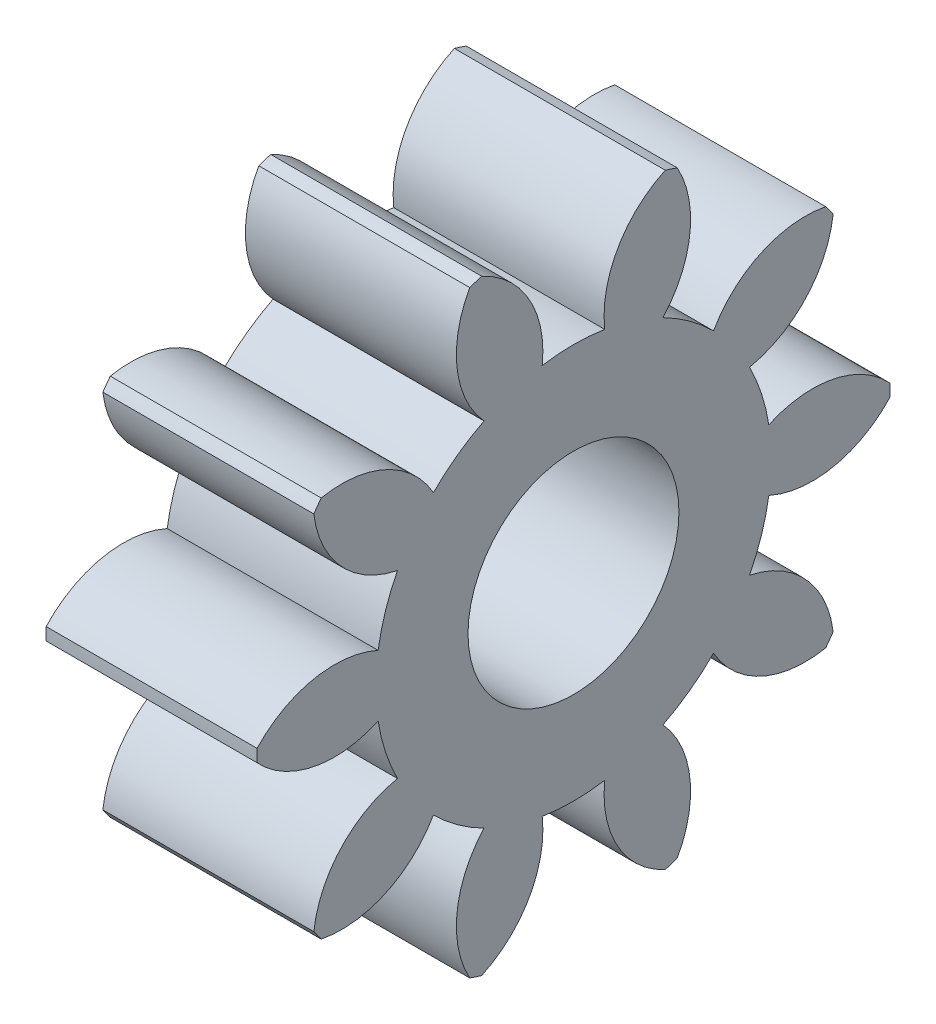
from build123d import *

# Parameters (mm, degrees)
BASPROSKE_W     = 4
BASPROSKE_H     = 6
TOOTHCUT_DEPTH  = 10.38083152
TEETHCUTS_COUNT = 10
TEETHCUTS_ANGLE = 324
BORSKE_R        = 2
BORE_DEPTH      = 50.0000508


with BuildPart() as part:
    # BasProSke → Base-Revolve (revolve)
    with BuildSketch(Plane(origin=(0, 0, 0), x_dir=(1, 0, 0), z_dir=(0, 1, 0))):
        with Locations((2, 3)):
            Rectangle(BASPROSKE_W, BASPROSKE_H)
    revolve(axis=Axis((-10, 0, 0), (1, 0, 0)))

    # TooCutSke → ToothCut (cut, through all)
    with BuildSketch(Plane(origin=(0, 0, 0), x_dir=(0, 0, -1), z_dir=(1, 0, 0))):
        with BuildLine():
            ThreePointArc((0.59278292, 3.701838653), (0, 3.749), (-0.59278292, 3.701838653))
            ThreePointArc((-0.59278292, 3.701838653), (-0.846593509, 4.924114224), (-1.775771316, 5.757784417))
            ThreePointArc((-1.775771316, 5.757784417), (0, 6.0254), (1.775771316, 5.757784417))
            ThreePointArc((1.775771316, 5.757784417), (0.846593509, 4.924114224), (0.59278292, 3.701838653))
        make_face()
    toothcut = extrude(amount=TOOTHCUT_DEPTH, mode=Mode.SUBTRACT)

    # TeethCuts: ToothCut ×10 about axis
    teethcuts_axis = Axis((-10, 0, 0), (1, 0, 0))
    for i in range(1, TEETHCUTS_COUNT):
        add(toothcut.rotate(teethcuts_axis, i * TEETHCUTS_ANGLE / (TEETHCUTS_COUNT - 1)), mode=Mode.SUBTRACT)

    # BorSke → Bore (cut, symmetric)
    with BuildSketch(Plane(origin=(0, 0, 0), x_dir=(0, 0, -1), z_dir=(1, 0, 0))):
        Circle(BORSKE_R)
    extrude(amount=BORE_DEPTH, both=True, mode=Mode.SUBTRACT)


solid = part.part
